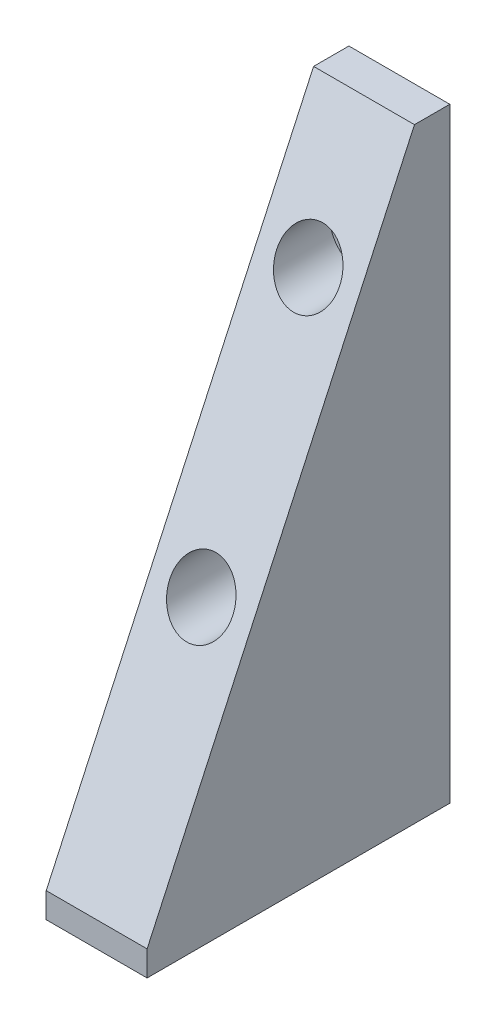
from build123d import *

# Parameters (mm, degrees)
BOSS_EXTRUDE2_DEPTH         = 25.4
CUT_EXTRUDE2_REACH          = 139.025
SKETCH7_R                   = 7.9375
F_3_8_16_TAPPED_HOLE1_D     = 7.9375
F_3_8_16_TAPPED_HOLE1_DEPTH = 25.4
F_3_8_16_TAPPED_HOLE1_TIP   = 2.384665582


with BuildPart() as part:
    # Sketch1 → Boss-Extrude2 (new body)
    with BuildSketch(Plane(origin=(0, 0, 0), x_dir=(0, 0, -1), z_dir=(1, 0, 0))):
        Polygon((21.525976172, 126.619), (-45.784023828, -19.431), (-45.784023828, -25.781), (30.415976172, -25.781), (30.415976172, 126.619), align=None)
    extrude(amount=BOSS_EXTRUDE2_DEPTH)

    # Sketch4 → CBORE for 3/8 Socket Head Cap Screw1 (revolve, cut)
    with BuildSketch(Plane(origin=(12.7, 96.139, -11.365976172), x_dir=(0, -1, 0), z_dir=(1, 0, 0))):
        Polygon((0, 0), (0, 19.05), (4.9022, 19.05), (4.9022, 9.525), (7.9375, 9.525), (7.9375, 0), align=None)
    revolve(axis=Axis((12.7, 96.139, -5.015976172), (0, 0, -1)), mode=Mode.SUBTRACT)

    # Sketch6 → CBORE for 3/8 Socket Head Cap Screw2 (revolve, cut)
    with BuildSketch(Plane(origin=(12.7, 37.719, -10.095976172), x_dir=(0, -1, 0), z_dir=(1, 0, 0))):
        Polygon((0, 0), (0, 20.32), (4.9022, 20.32), (4.9022, 9.525), (7.9375, 9.525), (7.9375, 0), align=None)
    revolve(axis=Axis((12.7, 37.719, -3.745976172), (0, 0, -1)), mode=Mode.SUBTRACT)

    # Sketch7 → Cut-Extrude2 (cut, up to next)
    with BuildSketch(Plane(origin=(0, 96.139, -11.365976172), x_dir=(1, 0, 0), z_dir=(0, 0, 1)), mode=Mode.PRIVATE) as cut_extrude2_sk1:
        with Locations((12.7, -58.42)):
            Circle(SKETCH7_R)
    cut_extrude2_tool1 = extrude(cut_extrude2_sk1.sketch, amount=CUT_EXTRUDE2_REACH, mode=Mode.PRIVATE) & part.part
    # Sketch7 → Cut-Extrude2 (cut, up to next)
    with BuildSketch(Plane(origin=(0, 96.139, -11.365976172), x_dir=(1, 0, 0), z_dir=(0, 0, 1)), mode=Mode.PRIVATE) as cut_extrude2_sk2:
        with Locations((12.7, 0)):
            Circle(SKETCH7_R)
    cut_extrude2_tool2 = extrude(cut_extrude2_sk2.sketch, amount=CUT_EXTRUDE2_REACH, mode=Mode.PRIVATE) & part.part
    add(cut_extrude2_tool1.solids().sort_by_distance((12.7, 37.719, -11.365976))[0], mode=Mode.SUBTRACT)
    add(cut_extrude2_tool2.solids().sort_by_distance((12.7, 96.139, -11.365976))[0], mode=Mode.SUBTRACT)

    # 3/8-16 Tapped Hole1
    with Locations(Plane(origin=(12.7, -25.781, -15.175976172), x_dir=(0, 0, -1), z_dir=(0, -1, 0))):
        with Locations((0, 0), (-40.64, 0)):
            Hole(F_3_8_16_TAPPED_HOLE1_D / 2, depth=F_3_8_16_TAPPED_HOLE1_DEPTH)
            with Locations((0, 0, -(F_3_8_16_TAPPED_HOLE1_DEPTH + F_3_8_16_TAPPED_HOLE1_TIP / 2))):  # 118° drill point
                Cone(0, F_3_8_16_TAPPED_HOLE1_D / 2, F_3_8_16_TAPPED_HOLE1_TIP, mode=Mode.SUBTRACT)


solid = part.part
